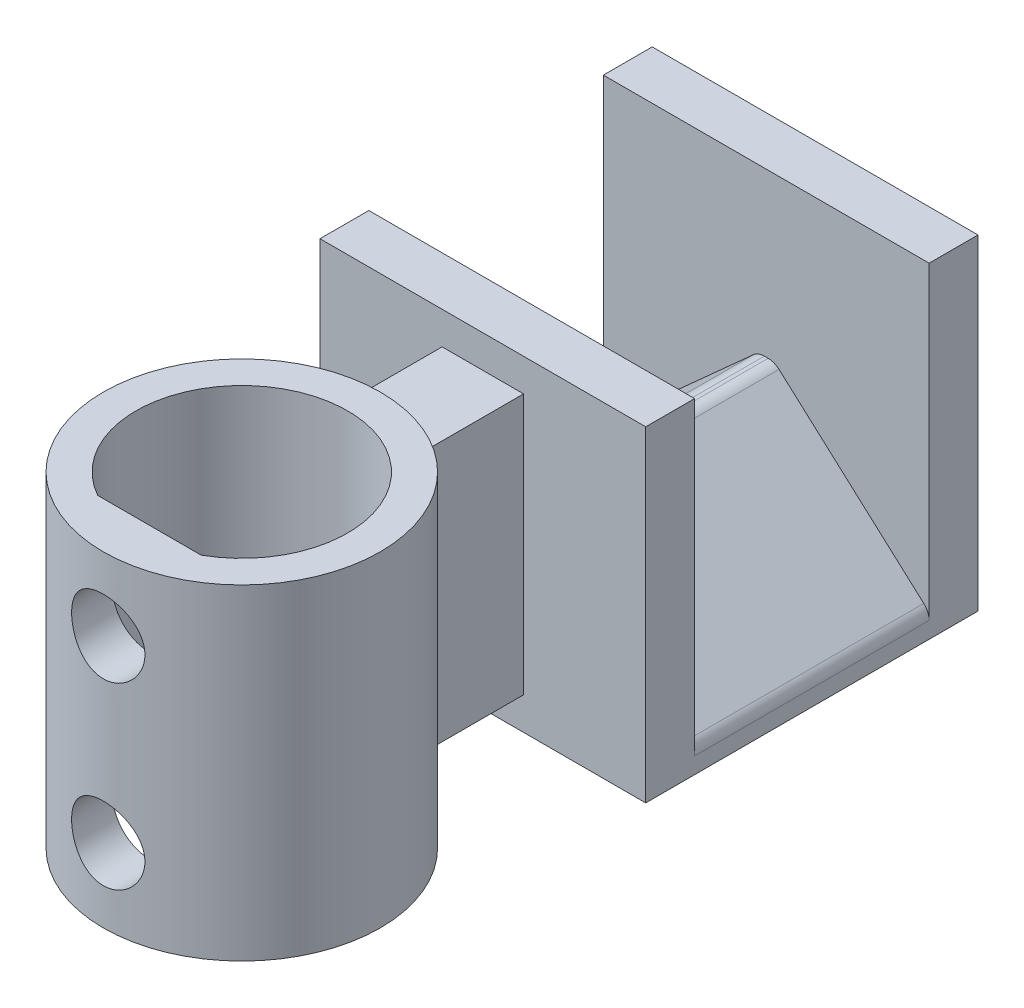
from build123d import *

# Parameters (mm, degrees)
SKETCH2_W                       = 20
SKETCH2_H                       = 10
BOSS_EXTRUDE1_DEPTH             = 7.2
CHAMFER1_SIZE                   = 9.5
CHAMFER1_SIZE2                  = 8.553838421
FILLET3_R                       = 1
SKETCH3_W                       = 20
SKETCH3_H                       = 20
BOSS_EXTRUDE2_DEPTH             = 3
BOSS_EXTRUDE3_REACH             = 22.713
SKETCH6_R                       = 8.5
BOSS_EXTRUDE3_DIRECTION_2_REACH = 22.713
BOSS_EXTRUDE4_REACH             = 31.46
BOSS_EXTRUDE4_END_RADIUS        = 8.5
SKETCH5_W                       = 5
SKETCH5_H                       = 16
CUT_EXTRUDE1_REACH              = 37.172
CUT_EXTRUDE1_END_RADIUS         = 8.5
SKETCH7_R                       = 2.25


with BuildPart() as part:
    # Sketch2 → Boss-Extrude1 (new, symmetric)
    with BuildSketch(Plane.XY):
        Rectangle(SKETCH2_W, SKETCH2_H)
    extrude(amount=BOSS_EXTRUDE1_DEPTH, both=True)

    # Chamfer1
    chamfer1_edges = [part.edges().sort_by_distance(p)[0] for p in [
        (10, 5, 0),
        (-10, 5, 0),
    ]]
    chamfer1_side = [part.faces().sort_by_distance(p)[0] for p in [
        (0, 5, 0),
    ]]
    chamfer(chamfer1_edges, length=CHAMFER1_SIZE, length2=CHAMFER1_SIZE2, reference=chamfer1_side[0])

    # Fillet3
    fillet3_edges = [part.edges().sort_by_distance(p)[0] for p in [
        (-10, -3.553838421, 0),
        (10, -3.553838421, 0),
        (0.5, 5, 0),
        (-0.5, 5, 0),
    ]]
    fillet(fillet3_edges, radius=FILLET3_R)

    # Sketch3 → Boss-Extrude2 (add)
    with BuildSketch(Plane.XY.offset(7.2)):
        with Locations((0, 5)):
            Rectangle(SKETCH3_W, SKETCH3_H)
    boss_extrude2 = extrude(amount=BOSS_EXTRUDE2_DEPTH)

    # Mirror1: Boss-Extrude2 across plane
    add(boss_extrude2.mirror(Plane.XY))


with BuildPart() as body_2:

    # Boss-Extrude3: up to this face of the body (flat: up to its plane)
    boss_extrude3_end = Plane(part.part.faces().sort_by_distance((0, 15, 8.7))[0])
    # Sketch6 → Boss-Extrude3 (new, up to the picked face)
    with BuildSketch(Plane(origin=(0, 0, 0), x_dir=(1, 0, 0), z_dir=(0, 1, 0)), mode=Mode.PRIVATE) as boss_extrude3_sk1:
        with Locations((0, -25)):
            Circle(SKETCH6_R)
        with BuildLine():
            Line((3.175, -30.671805268), (-3.175, -30.671805268))
            ThreePointArc((-3.175, -30.671805268), (0, -18.5), (3.175, -30.671805268))
        make_face(mode=Mode.SUBTRACT)
    boss_extrude3_tool1 = split(extrude(boss_extrude3_sk1.sketch, amount=BOSS_EXTRUDE3_REACH, mode=Mode.PRIVATE), bisect_by=boss_extrude3_end, keep=Keep.BOTH, mode=Mode.PRIVATE)
    add(boss_extrude3_tool1.solids().sort_by(Axis((-8.259584, 0, 25), (0, 1, 0)))[0])


    # Boss-Extrude3 direction 2: up to this face of the body (flat: up to its plane)
    boss_extrude3_direction_2_end = Plane(part.part.faces().sort_by_distance((0, -5, 0))[0])
    # Sketch6 → Boss-Extrude3 direction 2 (add, up to the picked face)
    with BuildSketch(Plane(origin=(0, 0, 0), x_dir=(1, 0, 0), z_dir=(0, 1, 0)), mode=Mode.PRIVATE) as boss_extrude3_direction_2_sk1:
        with Locations((0, -25)):
            Circle(SKETCH6_R)
        with BuildLine():
            Line((3.175, -30.671805268), (-3.175, -30.671805268))
            ThreePointArc((-3.175, -30.671805268), (0, -18.5), (3.175, -30.671805268))
        make_face(mode=Mode.SUBTRACT)
    boss_extrude3_direction_2_tool1 = split(extrude(boss_extrude3_direction_2_sk1.sketch, amount=-BOSS_EXTRUDE3_DIRECTION_2_REACH, mode=Mode.PRIVATE), bisect_by=boss_extrude3_direction_2_end, keep=Keep.BOTH, mode=Mode.PRIVATE)
    add(boss_extrude3_direction_2_tool1.solids().sort_by(Axis((-8.259584, 0, 25), (0, -1, 0)))[0])


with BuildPart() as part_1:
    add(part.part)

    add(body_2.part)  # Boss-Extrude4 merges body 2
    # Boss-Extrude4: up to this cylinder (the profile starts outside it)
    boss_extrude4_end = Plane(origin=(0, 5, 25), z_dir=(0, -1, 0)) * Cylinder(BOSS_EXTRUDE4_END_RADIUS, 80.92, mode=Mode.PRIVATE)
    # Sketch5 → Boss-Extrude4 (add, up to the surface)
    with BuildSketch(Plane.XY.offset(10.2), mode=Mode.PRIVATE) as boss_extrude4_sk1:
        with Locations((0, 5)):
            Rectangle(SKETCH5_W, SKETCH5_H)
    boss_extrude4_tool1 = extrude(boss_extrude4_sk1.sketch, amount=BOSS_EXTRUDE4_REACH, mode=Mode.PRIVATE) - boss_extrude4_end
    add(boss_extrude4_tool1.solids().sort_by_distance((0, 5, 10.2))[0])

    # Cut-Extrude1: up to this cylinder (the profile starts inside it)
    cut_extrude1_end = Plane(origin=(0, 5, 25), z_dir=(0, -1, 0)) * Cylinder(CUT_EXTRUDE1_END_RADIUS, 103.344, mode=Mode.PRIVATE)
    # Sketch7 → Cut-Extrude1 (cut, up to the surface)
    with BuildSketch(Plane.XY.offset(20), mode=Mode.PRIVATE) as cut_extrude1_sk1:
        with Locations((0, 10.5)):
            Circle(SKETCH7_R)
    cut_extrude1_tool1 = extrude(cut_extrude1_sk1.sketch, amount=CUT_EXTRUDE1_REACH, mode=Mode.PRIVATE) & cut_extrude1_end
    add(cut_extrude1_tool1.solids().sort_by_distance((0, 10.5, 20))[0], mode=Mode.SUBTRACT)
    # Sketch7 → Cut-Extrude1 (cut, up to the surface)
    with BuildSketch(Plane.XY.offset(20), mode=Mode.PRIVATE) as cut_extrude1_sk2:
        with Locations((0, -0.5)):
            Circle(SKETCH7_R)
    cut_extrude1_tool2 = extrude(cut_extrude1_sk2.sketch, amount=CUT_EXTRUDE1_REACH, mode=Mode.PRIVATE) & cut_extrude1_end
    add(cut_extrude1_tool2.solids().sort_by_distance((0, -0.5, 20))[0], mode=Mode.SUBTRACT)


solid = part_1.part
